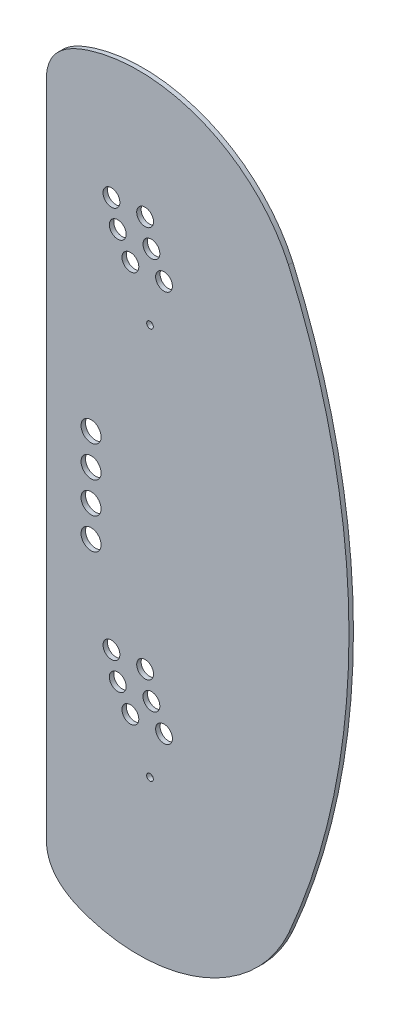
from build123d import *

# Parameters (mm, degrees)
SKETCH1_R           = 4.7625
SKETCH1_R_2         = 12.0000014
SKETCH1_R_3         = 14.2875
SKETCH1_R_4         = 11.999960371
BOSS_EXTRUDE1_DEPTH = 6.35


with BuildPart() as part:
    # Sketch1 → Boss-Extrude1 (new body)
    with BuildSketch(Plane.XY):
        with BuildLine():
            add(Edge.make_bspline(
                [(1361.096561672, 1948.863494174), (1364.400827848, 1984.023171072), (1498.613211066, 2056.462277252), (1658.30760281, 1990.654880293), (1706.236065024, 1885.549246122)],
                knots=[0, 0, 0, 0, 0.219674411, 1, 1, 1, 1], degree=3))
            Line((1361.096561672, 1948.863494174), (1361.096561672, 996.363494176))
            add(Edge.make_bspline(
                [(1361.096561672, 996.363494176), (1364.400827848, 961.203817278), (1498.613211066, 888.764711097), (1658.30760281, 954.572108057), (1706.236065024, 1059.677742228)],
                knots=[0, 0, 0, 0, 0.219674411, 1, 1, 1, 1], degree=3))
            ThreePointArc((1706.236065024, 1059.677742228), (1792.519416012, 1472.613494175), (1706.236065024, 1885.549246122))
        make_face()
        with Locations((1508.664375126, 1153.814512828)):
            Circle(SKETCH1_R, mode=Mode.SUBTRACT)
        with Locations((1462.664908629, 1248.814538752)):
            Circle(SKETCH1_R_2, mode=Mode.SUBTRACT)
        with Locations((1453.664901229, 1283.814468752)):
            Circle(SKETCH1_R_2, mode=Mode.SUBTRACT)
        with Locations((1424.596561672, 1405.938494174)):
            Circle(SKETCH1_R_3, mode=Mode.SUBTRACT)
        with Locations((1424.596561672, 1450.388494174)):
            Circle(SKETCH1_R_3, mode=Mode.SUBTRACT)
        with Locations((1480.664970258, 1217.564562981)):
            Circle(SKETCH1_R_2, mode=Mode.SUBTRACT)
        with Locations((1510.664904526, 1248.814576828)):
            Circle(SKETCH1_R_2, mode=Mode.SUBTRACT)
        with Locations((1501.664897126, 1283.814506828)):
            Circle(SKETCH1_R_2, mode=Mode.SUBTRACT)
        with Locations((1528.664901326, 1217.564562981)):
            Circle(SKETCH1_R_2, mode=Mode.SUBTRACT)
        with Locations((1424.596561672, 1494.838494174)):
            Circle(SKETCH1_R_3, mode=Mode.SUBTRACT)
        with Locations((1424.596561672, 1539.288494174)):
            Circle(SKETCH1_R_3, mode=Mode.SUBTRACT)
        with Locations((1508.664375126, 1712.614512828)):
            Circle(SKETCH1_R, mode=Mode.SUBTRACT)
        with Locations((1462.664975126, 1807.614576828)):
            Circle(SKETCH1_R_2, mode=Mode.SUBTRACT)
        with Locations((1453.664967726, 1842.614506828)):
            Circle(SKETCH1_R_2, mode=Mode.SUBTRACT)
        with Locations((1480.66492898, 1776.364555337)):
            Circle(SKETCH1_R_4, mode=Mode.SUBTRACT)
        with Locations((1510.664904526, 1807.614576828)):
            Circle(SKETCH1_R_2, mode=Mode.SUBTRACT)
        with Locations((1501.664897126, 1842.614506828)):
            Circle(SKETCH1_R_2, mode=Mode.SUBTRACT)
        with Locations((1528.664893926, 1776.364575828)):
            Circle(SKETCH1_R_2, mode=Mode.SUBTRACT)
    extrude(amount=BOSS_EXTRUDE1_DEPTH)


solid = part.part
